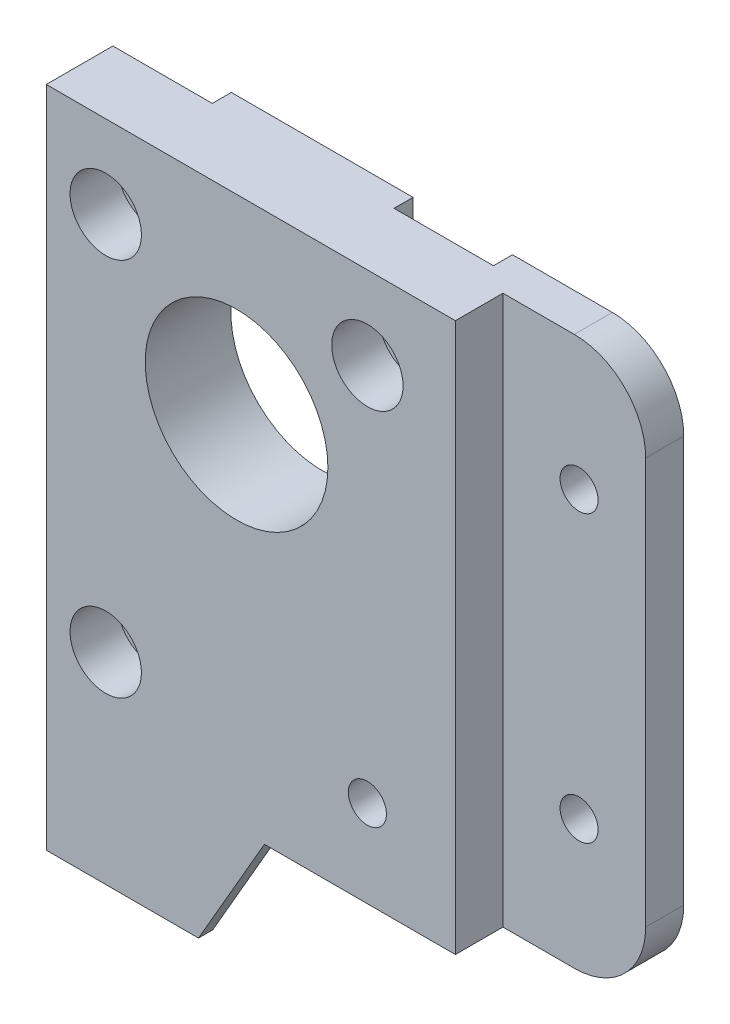
from build123d import *

# Parameters (mm, degrees)
SKETCH1_R           = 4.2
SKETCH1_R_2         = 9.6
BOSS_EXTRUDE1_DEPTH = 2
SKETCH4_W           = 58
SKETCH4_H           = 57.7
SKETCH4_R           = 2
SKETCH4_R_2         = 9.6
BOSS_EXTRUDE3_DEPTH = 2
SKETCH5_R           = 2
CUT_EXTRUDE1_DEPTH  = 4
SKETCH6_W           = 43
SKETCH6_H           = 57.7
SKETCH6_R           = 3.75
SKETCH6_R_2         = 9.6
SKETCH6_R_3         = 2
BOSS_EXTRUDE4_DEPTH = 5
CUT_EXTRUDE2_DEPTH  = 48.972101267
BOSS_EXTRUDE5_DEPTH = 6
BOSS_EXTRUDE6_DEPTH = 1.5


with BuildPart() as part:
    # Sketch1 → Boss-Extrude1 (new body)
    with BuildSketch(Plane.XY):
        with BuildLine():
            Line((38, 28.85), (20, 28.85))
            Line((20, 28.85), (20, 21.79369023))
            Line((20, 21.79369023), (17.201699017, 17.757141063))
            ThreePointArc((17.201699017, 17.757141063), (12.496432266, 16.141438171), (9.55, 20.15))
            Line((9.55, 20.15), (9.55, 28.85))
            Line((9.55, 28.85), (-9.55, 28.85))
            Line((-9.55, 28.85), (-9.55, 20.15))
            ThreePointArc((-9.55, 20.15), (-12.496432266, 16.141438171), (-17.201699017, 17.757141063))
            Line((-17.201699017, 17.757141063), (-20, 21.79369023))
            Line((-20, 21.79369023), (-20, -16.371914064))
            Line((-20, -16.371914064), (-16.312, -16.371914064))
            Line((-16.312, -16.371914064), (-12.349992933, -13.321914064))
            ThreePointArc((-12.349992933, -13.321914064), (-6.459906996, -14.088), (-7.225992933, -19.978085936))
            Line((-7.225992933, -19.978085936), (-11.188, -23.028085936))
            ThreePointArc((-11.188, -23.028085936), (-12.396848296, -23.676050863), (-13.75, -23.9))
            Line((-13.75, -23.9), (-20, -23.9))
            Line((-20, -23.9), (-20, -28.85))
            Line((-20, -28.85), (9.55, -28.85))
            Line((9.55, -28.85), (9.55, -19.7))
            ThreePointArc((9.55, -19.7), (12.496432266, -15.691438171), (17.201699017, -17.307141063))
            Line((17.201699017, -17.307141063), (20, -21.34369023))
            Line((20, -21.34369023), (20, -28.85))
            Line((20, -28.85), (38, -28.85))
            Line((38, -28.85), (38, 28.85))
        make_face()
        with Locations((-5.725, -6.1)):
            Circle(SKETCH1_R, mode=Mode.SUBTRACT)
        with Locations((5.725, -6.1)):
            Circle(SKETCH1_R, mode=Mode.SUBTRACT)
        with Locations((0, 8.8)):
            Circle(SKETCH1_R_2, mode=Mode.SUBTRACT)
    extrude(amount=BOSS_EXTRUDE1_DEPTH)

    # Sketch4 → Boss-Extrude3 (add)
    with BuildSketch(Plane.XY.offset(2)):
        with Locations((9, 0)):
            Rectangle(SKETCH4_W, SKETCH4_H)
        with Locations((13.75, -19.7)):
            Circle(SKETCH4_R, mode=Mode.SUBTRACT)
        with Locations((-13.75, 20.15)):
            Circle(SKETCH4_R, mode=Mode.SUBTRACT)
        with Locations((13.75, 20.15)):
            Circle(SKETCH4_R, mode=Mode.SUBTRACT)
        with Locations((-13.75, -19.7)):
            Circle(SKETCH4_R, mode=Mode.SUBTRACT)
        with Locations((0, 8.8)):
            Circle(SKETCH4_R_2, mode=Mode.SUBTRACT)
    extrude(amount=BOSS_EXTRUDE3_DEPTH)

    # Sketch5 → Cut-Extrude1 (cut)
    with BuildSketch(Plane.XY.offset(4)):
        with Locations((31, 15)):
            Circle(SKETCH5_R)
        with Locations((31, -15)):
            Circle(SKETCH5_R)
    extrude(amount=-CUT_EXTRUDE1_DEPTH, mode=Mode.SUBTRACT)

    # Sketch6 → Boss-Extrude4 (add)
    with BuildSketch(Plane.XY.offset(4)):
        with Locations((1.5, 0)):
            Rectangle(SKETCH6_W, SKETCH6_H)
        with Locations((-13.75, -19.7)):
            Circle(SKETCH6_R, mode=Mode.SUBTRACT)
        with Locations((0, 8.8)):
            Circle(SKETCH6_R_2, mode=Mode.SUBTRACT)
        with Locations((-13.75, 20.15)):
            Circle(SKETCH6_R, mode=Mode.SUBTRACT)
        with Locations((13.75, 20.15)):
            Circle(SKETCH6_R, mode=Mode.SUBTRACT)
        with Locations((13.75, -19.7)):
            Circle(SKETCH6_R_3, mode=Mode.SUBTRACT)
    extrude(amount=BOSS_EXTRUDE4_DEPTH)

    # Sketch7 → Cut-Extrude2 (cut, through all)
    with BuildSketch(Plane.XY.offset(4)):
        with BuildLine():
            Line((30.5, 28.85), (38, 28.85))
            Line((38, 28.85), (38, 21.35))
            ThreePointArc((38, 21.35), (35.803300859, 26.653300859), (30.5, 28.85))
        make_face()
        with BuildLine():
            Line((38, -28.85), (38, -21.35))
            ThreePointArc((38, -21.35), (35.803300859, -26.653300859), (30.5, -28.85))
            Line((30.5, -28.85), (38, -28.85))
        make_face()
    extrude(amount=-CUT_EXTRUDE2_DEPTH, mode=Mode.SUBTRACT)

    # Sketch9 → Boss-Extrude5 (add)
    with BuildSketch(Plane.ZY.offset(20)):
        Polygon((9, -28.85), (9, -40.85), (0, -40.85), (0, -35.15), (3, -35.15), (3, -28.85), align=None)
    extrude(amount=-BOSS_EXTRUDE5_DEPTH)

    # Sketch10 → Boss-Extrude6 (add)
    with BuildSketch(Plane.XY.offset(9)):
        Polygon((-14, -40.85), (-4, -40.85), (2.92820323, -28.85), (-14, -28.85), align=None)
    extrude(amount=-BOSS_EXTRUDE6_DEPTH)


solid = part.part
